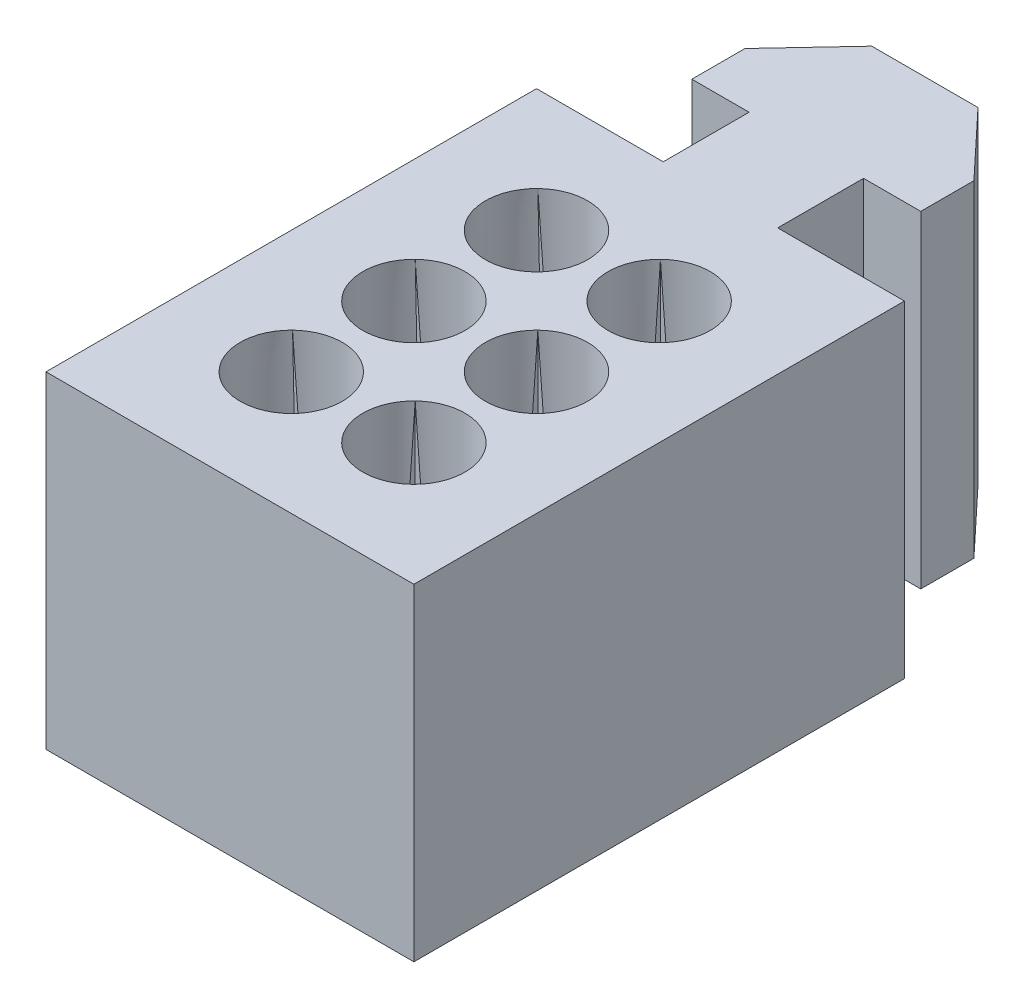
from build123d import *

# Parameters (mm, degrees)
SKETCH_1_W                    = 9
SKETCH_1_H                    = 12
SKETCH_1_R                    = 1.25
EXTRUDE_1_DEPTH               = 10
CHAMFER_1_SIZE                = 2
CHAMFER_1_SIZE_2              = 1.562571253
EXTRUDE_2_DEPTH               = 8
CUT_EXTRUDE_2_DEPTH           = 10
CUT_EXTRUDE_2_DRAFT           = 2
CUT_EXTRUDE_2_PROFILE_2_DEPTH = 10
CUT_EXTRUDE_2_PROFILE_2_DRAFT = 2
CUT_EXTRUDE_2_PROFILE_3_DEPTH = 10
CUT_EXTRUDE_2_PROFILE_3_DRAFT = 2
CUT_EXTRUDE_2_PROFILE_4_DEPTH = 10
CUT_EXTRUDE_2_PROFILE_4_DRAFT = 2
CUT_EXTRUDE_2_PROFILE_5_DEPTH = 10
CUT_EXTRUDE_2_PROFILE_5_DRAFT = 2
CUT_EXTRUDE_2_PROFILE_6_DEPTH = 10
CUT_EXTRUDE_2_PROFILE_6_DRAFT = 2
SKETCH_4_W                    = 14.61483725
SKETCH_4_H                    = 18.540833391
CUT_EXTRUDE_3_DEPTH           = 18.204650581


with BuildPart() as part:
    # Эскиз1 → Бобышка-Вытянуть1 (new body)
    with BuildSketch(Plane(origin=(0, 0, 0), x_dir=(1, 0, 0), z_dir=(0, 1, 0))):
        with Locations((1.5, 3)):
            Rectangle(SKETCH_1_W, SKETCH_1_H)
        with Locations(Location((0, 0, 0), (0, 0, 270))):
            Circle(SKETCH_1_R, mode=Mode.SUBTRACT)
        with Locations(Location((3, 0, 0), (0, 0, 270))):
            Circle(SKETCH_1_R, mode=Mode.SUBTRACT)
        with Locations(Location((3, 3, 0), (0, 0, 270))):
            Circle(SKETCH_1_R, mode=Mode.SUBTRACT)
        with Locations(Location((3, 6, 0), (0, 0, 270))):
            Circle(SKETCH_1_R, mode=Mode.SUBTRACT)
        with Locations(Location((0, 3, 0), (0, 0, 270))):
            Circle(SKETCH_1_R, mode=Mode.SUBTRACT)
        with Locations(Location((0, 6, 0), (0, 0, 270))):
            Circle(SKETCH_1_R, mode=Mode.SUBTRACT)
    extrude(amount=EXTRUDE_1_DEPTH)

    # Фаска1
    # the kernel refuses this chamfer: 2, 1.562571253 mm, written as the material it takes off along each edge
    with BuildSketch(Plane(origin=(0, 0, 0), x_dir=(0, 0, 1), z_dir=(-1, 0, 0))) as chamfer_1_piece_1:
        Polygon((1.25, CHAMFER_1_SIZE), (1.25 + CHAMFER_1_SIZE_2, 0), (1.25, 0), align=None)
    revolve(axis=Axis((0, 0, 0), (0, 1, 0)), mode=Mode.SUBTRACT)
    with BuildSketch(Plane(origin=(3, 0, 0), x_dir=(0, 0, 1), z_dir=(-1, 0, 0))) as chamfer_1_piece_2:
        Polygon((1.25, CHAMFER_1_SIZE), (1.25 + CHAMFER_1_SIZE_2, 0), (1.25, 0), align=None)
    revolve(axis=Axis((3, 0, 0), (0, 1, 0)), mode=Mode.SUBTRACT)
    with BuildSketch(Plane(origin=(3, 0, -3), x_dir=(0, 0, 1), z_dir=(-1, 0, 0))) as chamfer_1_piece_3:
        Polygon((1.25, CHAMFER_1_SIZE), (1.25 + CHAMFER_1_SIZE_2, 0), (1.25, 0), align=None)
    revolve(axis=Axis((3, 0, -3), (0, 1, 0)), mode=Mode.SUBTRACT)
    with BuildSketch(Plane(origin=(3, 0, -6), x_dir=(0, 0, 1), z_dir=(-1, 0, 0))) as chamfer_1_piece_4:
        Polygon((1.25, CHAMFER_1_SIZE), (1.25 + CHAMFER_1_SIZE_2, 0), (1.25, 0), align=None)
    revolve(axis=Axis((3, 0, -6), (0, 1, 0)), mode=Mode.SUBTRACT)
    with BuildSketch(Plane(origin=(0, 0, -3), x_dir=(0, 0, 1), z_dir=(-1, 0, 0))) as chamfer_1_piece_5:
        Polygon((1.25, CHAMFER_1_SIZE), (1.25 + CHAMFER_1_SIZE_2, 0), (1.25, 0), align=None)
    revolve(axis=Axis((0, 0, -3), (0, 1, 0)), mode=Mode.SUBTRACT)
    with BuildSketch(Plane(origin=(0, 0, -6), x_dir=(0, 0, 1), z_dir=(-1, 0, 0))) as chamfer_1_piece_6:
        Polygon((1.25, CHAMFER_1_SIZE), (1.25 + CHAMFER_1_SIZE_2, 0), (1.25, 0), align=None)
    revolve(axis=Axis((0, 0, -6), (0, 1, 0)), mode=Mode.SUBTRACT)

    # Эскиз2 → Бобышка-Вытянуть2 (add)
    with BuildSketch(Plane(origin=(0, 0, 0), x_dir=(1, 0, 0), z_dir=(0, 1, 0))):
        Polygon((0.1, 9), (0.1, 11.1), (-1.3, 11.1), (-1.3, 12.4), (0.2, 14), (2.8, 14), (4.3, 12.4), (4.3, 11.1), (2.9, 11.1), (2.9, 9), align=None)
    extrude(amount=EXTRUDE_2_DEPTH)


with BuildPart() as cut_extrude_2_tool:
    # Эскиз3 → Вырез-Вытянуть2 (with draft: the straight prism first)
    with BuildSketch(Plane(origin=(0, 8, 0), x_dir=(1, 0, 0), z_dir=(0, 1, 0))):
        with BuildLine():
            Line((0.867865543, 6.899616251), (-0.867865543, 6.899616251))
            ThreePointArc((-0.867865543, 6.899616251), (-1.25, 6), (-0.867865543, 5.100383749))
            Line((-0.867865543, 5.100383749), (0.867865543, 5.100383749))
            Line((0.867865543, 5.100383749), (0.867865543, 6.899616251))
        make_face()
    extrude(amount=-CUT_EXTRUDE_2_DEPTH)
    # Вырез-Вытянуть2: the draft: its side faces are tilted about the plane it starts from
    cut_extrude_2_sides = [cut_extrude_2_tool.faces().sort_by_distance(p)[0] for p in [
        (0, 3, -5.100383749),
        (0.867865543, 3, -6),
        (0, 3, -6.899616251),
        (-1.25, 3, -6),
    ]]
    draft(cut_extrude_2_sides, Plane(origin=(0, 8, 0), x_dir=(1, 0, 0), z_dir=(0, 1, 0)), CUT_EXTRUDE_2_DRAFT)


with BuildPart() as part_1:
    add(part.part)

    # Вырез-Вытянуть2: cut by cut_extrude_2_tool
    add(cut_extrude_2_tool.part, mode=Mode.SUBTRACT)


with BuildPart() as cut_extrude_2_profile_2_tool:
    # Эскиз3 → Вырез-Вытянуть2 profile 2 (with draft: the straight prism first)
    with BuildSketch(Plane(origin=(0, 8, 0), x_dir=(1, 0, 0), z_dir=(0, 1, 0))):
        with BuildLine():
            Line((2.132134457, 6.899616251), (2.132134457, 5.100383749))
            Line((2.132134457, 5.100383749), (3.867865543, 5.100383749))
            ThreePointArc((3.867865543, 5.100383749), (4.25, 6), (3.867865543, 6.899616251))
            Line((3.867865543, 6.899616251), (2.132134457, 6.899616251))
        make_face()
    extrude(amount=-CUT_EXTRUDE_2_PROFILE_2_DEPTH)
    # Вырез-Вытянуть2 profile 2: the draft: its side faces are tilted about the plane it starts from
    cut_extrude_2_profile_2_sides = [cut_extrude_2_profile_2_tool.faces().sort_by_distance(p)[0] for p in [
        (2.132134457, 3, -6),
        (3, 3, -5.100383749),
        (4.25, 3, -6),
        (3, 3, -6.899616251),
    ]]
    draft(cut_extrude_2_profile_2_sides, Plane(origin=(0, 8, 0), x_dir=(1, 0, 0), z_dir=(0, 1, 0)), CUT_EXTRUDE_2_PROFILE_2_DRAFT)


with BuildPart() as part_2:
    add(part_1.part)

    # Вырез-Вытянуть2 profile 2: cut by cut_extrude_2_profile_2_tool
    add(cut_extrude_2_profile_2_tool.part, mode=Mode.SUBTRACT)


with BuildPart() as cut_extrude_2_profile_3_tool:
    # Эскиз3 → Вырез-Вытянуть2 profile 3 (with draft: the straight prism first)
    with BuildSketch(Plane(origin=(0, 8, 0), x_dir=(1, 0, 0), z_dir=(0, 1, 0))):
        with BuildLine():
            Line((0.867865543, 3.899616251), (-0.867865543, 3.899616251))
            ThreePointArc((-0.867865543, 3.899616251), (-1.25, 3), (-0.867865543, 2.100383749))
            Line((-0.867865543, 2.100383749), (0.867865543, 2.100383749))
            Line((0.867865543, 2.100383749), (0.867865543, 3.899616251))
        make_face()
    extrude(amount=-CUT_EXTRUDE_2_PROFILE_3_DEPTH)
    # Вырез-Вытянуть2 profile 3: the draft: its side faces are tilted about the plane it starts from
    cut_extrude_2_profile_3_sides = [cut_extrude_2_profile_3_tool.faces().sort_by_distance(p)[0] for p in [
        (-1.25, 3, -3),
        (0, 3, -2.100383749),
        (0.867865543, 3, -3),
        (0, 3, -3.899616251),
    ]]
    draft(cut_extrude_2_profile_3_sides, Plane(origin=(0, 8, 0), x_dir=(1, 0, 0), z_dir=(0, 1, 0)), CUT_EXTRUDE_2_PROFILE_3_DRAFT)


with BuildPart() as part_3:
    add(part_2.part)

    # Вырез-Вытянуть2 profile 3: cut by cut_extrude_2_profile_3_tool
    add(cut_extrude_2_profile_3_tool.part, mode=Mode.SUBTRACT)


with BuildPart() as cut_extrude_2_profile_4_tool:
    # Эскиз3 → Вырез-Вытянуть2 profile 4 (with draft: the straight prism first)
    with BuildSketch(Plane(origin=(0, 8, 0), x_dir=(1, 0, 0), z_dir=(0, 1, 0))):
        with BuildLine():
            Line((2.132134457, 3.899616251), (2.132134457, 2.100383749))
            Line((2.132134457, 2.100383749), (3.867865543, 2.100383749))
            ThreePointArc((3.867865543, 2.100383749), (4.25, 3), (3.867865543, 3.899616251))
            Line((3.867865543, 3.899616251), (2.132134457, 3.899616251))
        make_face()
    extrude(amount=-CUT_EXTRUDE_2_PROFILE_4_DEPTH)
    # Вырез-Вытянуть2 profile 4: the draft: its side faces are tilted about the plane it starts from
    cut_extrude_2_profile_4_sides = [cut_extrude_2_profile_4_tool.faces().sort_by_distance(p)[0] for p in [
        (4.25, 3, -3),
        (3, 3, -3.899616251),
        (2.132134457, 3, -3),
        (3, 3, -2.100383749),
    ]]
    draft(cut_extrude_2_profile_4_sides, Plane(origin=(0, 8, 0), x_dir=(1, 0, 0), z_dir=(0, 1, 0)), CUT_EXTRUDE_2_PROFILE_4_DRAFT)


with BuildPart() as part_4:
    add(part_3.part)

    # Вырез-Вытянуть2 profile 4: cut by cut_extrude_2_profile_4_tool
    add(cut_extrude_2_profile_4_tool.part, mode=Mode.SUBTRACT)


with BuildPart() as cut_extrude_2_profile_5_tool:
    # Эскиз3 → Вырез-Вытянуть2 profile 5 (with draft: the straight prism first)
    with BuildSketch(Plane(origin=(0, 8, 0), x_dir=(1, 0, 0), z_dir=(0, 1, 0))):
        with BuildLine():
            Line((0.867865543, 0.899616251), (-0.867865543, 0.899616251))
            ThreePointArc((-0.867865543, 0.899616251), (-1.25, 0), (-0.867865543, -0.899616251))
            Line((-0.867865543, -0.899616251), (0.867865543, -0.899616251))
            Line((0.867865543, -0.899616251), (0.867865543, 0.899616251))
        make_face()
    extrude(amount=-CUT_EXTRUDE_2_PROFILE_5_DEPTH)
    # Вырез-Вытянуть2 profile 5: the draft: its side faces are tilted about the plane it starts from
    cut_extrude_2_profile_5_sides = [cut_extrude_2_profile_5_tool.faces().sort_by_distance(p)[0] for p in [
        (0, 3, 0.899616251),
        (0.867865543, 3, 0),
        (0, 3, -0.899616251),
        (-1.25, 3, 0),
    ]]
    draft(cut_extrude_2_profile_5_sides, Plane(origin=(0, 8, 0), x_dir=(1, 0, 0), z_dir=(0, 1, 0)), CUT_EXTRUDE_2_PROFILE_5_DRAFT)


with BuildPart() as part_5:
    add(part_4.part)

    # Вырез-Вытянуть2 profile 5: cut by cut_extrude_2_profile_5_tool
    add(cut_extrude_2_profile_5_tool.part, mode=Mode.SUBTRACT)


with BuildPart() as cut_extrude_2_profile_6_tool:
    # Эскиз3 → Вырез-Вытянуть2 profile 6 (with draft: the straight prism first)
    with BuildSketch(Plane(origin=(0, 8, 0), x_dir=(1, 0, 0), z_dir=(0, 1, 0))):
        with BuildLine():
            Line((2.132134457, 0.899616251), (2.132134457, -0.899616251))
            Line((2.132134457, -0.899616251), (3.867865543, -0.899616251))
            ThreePointArc((3.867865543, -0.899616251), (4.25, 0), (3.867865543, 0.899616251))
            Line((3.867865543, 0.899616251), (2.132134457, 0.899616251))
        make_face()
    extrude(amount=-CUT_EXTRUDE_2_PROFILE_6_DEPTH)
    # Вырез-Вытянуть2 profile 6: the draft: its side faces are tilted about the plane it starts from
    cut_extrude_2_profile_6_sides = [cut_extrude_2_profile_6_tool.faces().sort_by_distance(p)[0] for p in [
        (3, 3, -0.899616251),
        (2.132134457, 3, 0),
        (3, 3, 0.899616251),
        (4.25, 3, 0),
    ]]
    draft(cut_extrude_2_profile_6_sides, Plane(origin=(0, 8, 0), x_dir=(1, 0, 0), z_dir=(0, 1, 0)), CUT_EXTRUDE_2_PROFILE_6_DRAFT)


with BuildPart() as part_6:
    add(part_5.part)

    # Вырез-Вытянуть2 profile 6: cut by cut_extrude_2_profile_6_tool
    add(cut_extrude_2_profile_6_tool.part, mode=Mode.SUBTRACT)

    # Эскиз4 → Вырез-Вытянуть3 (cut, through all)
    with BuildSketch(Plane(origin=(0, 8, 0), x_dir=(1, 0, 0), z_dir=(0, 1, 0))):
        with Locations((2.348521747, 4.689471765)):
            Rectangle(SKETCH_4_W, SKETCH_4_H)
    extrude(amount=CUT_EXTRUDE_3_DEPTH, mode=Mode.SUBTRACT)


solid = part_6.part
